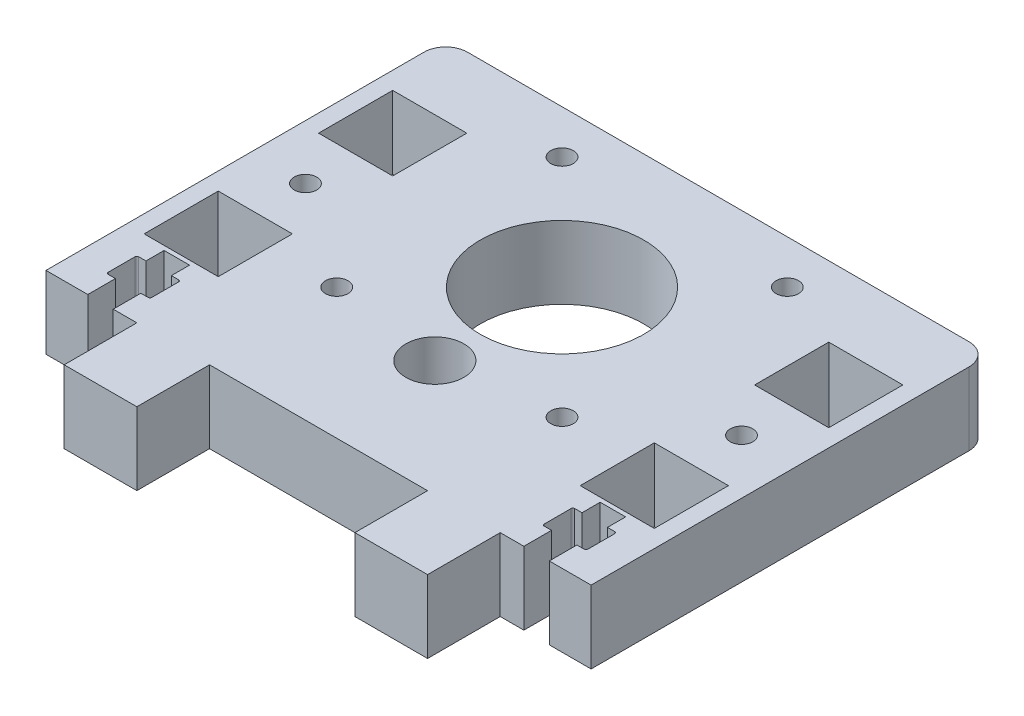
from build123d import *

# Parameters (mm, degrees)
SKETCH1_R        = 1.55
SKETCH1_W        = 10.2
SKETCH1_H        = 10.2
MAINLAYOUT_DEPTH = 10
TSLOT_DEPTH      = 53.936282454


with BuildPart() as part:
    # Sketch1 → MainLayout (new body)
    with BuildSketch(Plane(origin=(0, 0, 0), x_dir=(1, 0, 0), z_dir=(0, 1, 0))):
        with BuildLine():
            Line((-34.5, 29), (0, 29))
            Line((0, 29), (0, 18.75))
            ThreePointArc((0, 18.75), (-11.25, 7.5), (0, -3.75))
            Line((0, -3.75), (0, -6))
            ThreePointArc((0, -6), (-4, -10), (0, -14))
            Line((0, -14), (0, -26))
            Line((0, -26), (-15, -26))
            Line((-15, -26), (-15, -36))
            Line((-15, -36), (-25, -36))
            Line((-25, -36), (-25, -26))
            Line((-25, -26), (-37.5, -26))
            Line((-37.5, -26), (-37.5, 26))
            ThreePointArc((-37.5, 26), (-36.621320344, 28.121320344), (-34.5, 29))
        make_face()
        with Locations((-15.5, 23)):
            Circle(SKETCH1_R, mode=Mode.SUBTRACT)
        with Locations((-15.5, -8)):
            Circle(SKETCH1_R, mode=Mode.SUBTRACT)
        with Locations((-30, 2.2)):
            Circle(SKETCH1_R, mode=Mode.SUBTRACT)
        with Locations((-30, 14.2)):
            Rectangle(SKETCH1_W, SKETCH1_H, mode=Mode.SUBTRACT)
        with Locations((-30, -9.8)):
            Rectangle(SKETCH1_W, SKETCH1_H, mode=Mode.SUBTRACT)
    mainlayout = extrude(amount=MAINLAYOUT_DEPTH)

    # Sketch2 → TSlot (cut, through all)
    with BuildSketch(Plane(origin=(0, 10, 0), x_dir=(1, 0, 0), z_dir=(0, 1, 0))):
        with BuildLine():
            Line((-28.25, -22.2), (-28.25, -26))
            Line((-28.25, -26), (-31.75, -26))
            Line((-31.75, -26), (-31.75, -22.2))
            Line((-31.75, -22.2), (-32.75, -22.2))
            ThreePointArc((-32.75, -22.2), (-32.926776695, -22.126776695), (-33, -21.95))
            Line((-33, -21.95), (-33, -18.25))
            ThreePointArc((-33, -18.25), (-32.926776695, -18.073223305), (-32.75, -18))
            Line((-32.75, -18), (-31.75, -18))
            Line((-31.75, -18), (-31.75, -15.5))
            Line((-31.75, -15.5), (-28.25, -15.5))
            Line((-28.25, -15.5), (-28.25, -18))
            Line((-28.25, -18), (-27.25, -18))
            ThreePointArc((-27.25, -18), (-27.073223305, -18.073223305), (-27, -18.25))
            Line((-27, -18.25), (-27, -21.95))
            ThreePointArc((-27, -21.95), (-27.073223305, -22.126776695), (-27.25, -22.2))
            Line((-27.25, -22.2), (-28.25, -22.2))
        make_face()
    tslot = extrude(amount=-TSLOT_DEPTH, mode=Mode.SUBTRACT)

    # Mirror1: MainLayout, TSlot across plane
    add(mainlayout.mirror(Plane(origin=(0, 0, 0), x_dir=(0, 0, 1), z_dir=(1, 0, 0))))
    add(tslot.mirror(Plane(origin=(0, 0, 0), x_dir=(0, 0, 1), z_dir=(1, 0, 0))), mode=Mode.SUBTRACT)


solid = part.part
